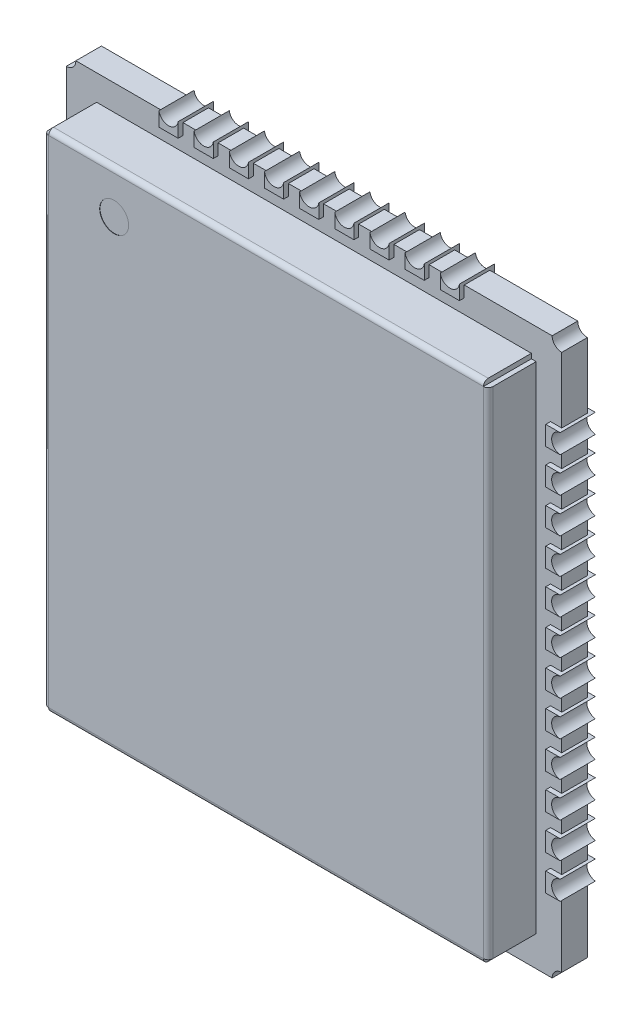
from build123d import *

# Parameters (mm, degrees)
SKETCH_1_W                     = 15.5
SKETCH_1_H                     = 17.4
EXTRUDE_1_DEPTH                = 0.8
SKETCH_2_W                     = 13.9
SKETCH_2_H                     = 15.8
EXTRUDE_2_DEPTH                = 1.5
SKETCH_3_W                     = 0.15
SKETCH_3_H                     = 0.15
CUT_EXTRUDE_1_DEPTH            = 1.5
FILLET_1_R                     = 0.15
EXTRUDE_START                  = -2.65
EXTRUDE_3_DEPTH                = 0.3
CUT_EXTRUDE_2_DEPTH            = 12.795550008
PATTERN_LINEAR_1_COUNT         = 12
PATTERN_LINEAR_1_PITCH         = 1.1
PATTERN_START                  = -2.65
PATTERN_LINEAR_1_COPY_1_DEPTH  = 0.3
PATTERN_LINEAR_1_COPY_2_DEPTH  = 0.3
PATTERN_LINEAR_1_COPY_3_DEPTH  = 0.3
PATTERN_LINEAR_1_COPY_4_DEPTH  = 0.3
PATTERN_LINEAR_1_COPY_5_DEPTH  = 0.3
PATTERN_LINEAR_1_COPY_6_DEPTH  = 0.3
PATTERN_LINEAR_1_COPY_7_DEPTH  = 0.3
PATTERN_LINEAR_1_COPY_8_DEPTH  = 0.3
PATTERN_LINEAR_1_COPY_9_DEPTH  = 0.3
PATTERN_LINEAR_1_COPY_10_DEPTH = 0.3
PATTERN_LINEAR_1_COPY_11_DEPTH = 0.3
PATTERN_LINEAR_1_COPY_12_DEPTH = 12.795550008
PATTERN_LINEAR_1_COPY_13_DEPTH = 12.795550008
PATTERN_LINEAR_1_COPY_14_DEPTH = 12.795550008
PATTERN_LINEAR_1_COPY_15_DEPTH = 12.795550008
PATTERN_LINEAR_1_COPY_16_DEPTH = 12.795550008
PATTERN_LINEAR_1_COPY_17_DEPTH = 12.795550008
PATTERN_LINEAR_1_COPY_18_DEPTH = 12.795550008
PATTERN_LINEAR_1_COPY_19_DEPTH = 12.795550008
PATTERN_LINEAR_1_COPY_20_DEPTH = 12.795550008
PATTERN_LINEAR_1_COPY_21_DEPTH = 12.795550008
PATTERN_LINEAR_1_COPY_22_DEPTH = 12.795550008
EXTRUDE_START_2                = -3.35
EXTRUDE_4_DEPTH                = 0.3
CUT_EXTRUDE_3_DEPTH            = 12.869498726
PATTERN_LINEAR_2_COUNT         = 9
PATTERN_LINEAR_2_PITCH         = 1.1
PATTERN_START_2                = -3.35
PATTERN_LINEAR_2_COPY_1_DEPTH  = 0.3
PATTERN_LINEAR_2_COPY_2_DEPTH  = 0.3
PATTERN_LINEAR_2_COPY_3_DEPTH  = 0.3
PATTERN_LINEAR_2_COPY_4_DEPTH  = 0.3
PATTERN_LINEAR_2_COPY_5_DEPTH  = 0.3
PATTERN_LINEAR_2_COPY_6_DEPTH  = 0.3
PATTERN_LINEAR_2_COPY_7_DEPTH  = 0.3
PATTERN_LINEAR_2_COPY_8_DEPTH  = 0.3
PATTERN_LINEAR_2_COPY_9_DEPTH  = 12.869498726
PATTERN_LINEAR_2_COPY_10_DEPTH = 12.869498726
PATTERN_LINEAR_2_COPY_11_DEPTH = 12.869498726
PATTERN_LINEAR_2_COPY_12_DEPTH = 12.869498726
PATTERN_LINEAR_2_COPY_13_DEPTH = 12.869498726
PATTERN_LINEAR_2_COPY_14_DEPTH = 12.869498726
PATTERN_LINEAR_2_COPY_15_DEPTH = 12.869498726
PATTERN_LINEAR_2_COPY_16_DEPTH = 12.869498726
SKETCH_10_W                    = 0.2
SKETCH_10_H                    = 0.6
CUT_EXTRUDE_5_DEPTH            = 0.15
SKETCH_11_W                    = 0.2
SKETCH_11_H                    = 0.6
EXTRUDE_5_DEPTH                = 0.15
EXTRUDE_6_DEPTH                = 0.15
SKETCH_13_W                    = 0.8
SKETCH_13_H                    = 1
EXTRUDE_7_DEPTH                = 0.15
SKETCH_14_W                    = 1
SKETCH_14_H                    = 0.8
EXTRUDE_8_DEPTH                = 0.15
PATTERN_LINEAR_3_COUNT         = 6
PATTERN_LINEAR_3_PITCH         = 1.4
SKETCH_15_W                    = 0.8
SKETCH_15_H                    = 1
EXTRUDE_9_DEPTH                = 0.15
PATTERN_LINEAR_5_COUNT         = 7
PATTERN_LINEAR_5_PITCH         = 1.4
SKETCH_16_W                    = 1
SKETCH_16_H                    = 0.8
EXTRUDE_10_DEPTH               = 0.15
PATTERN_LINEAR_6_COUNT         = 8
PATTERN_LINEAR_6_PITCH         = 1.4
PATTERN_LINEAR_7_COUNT         = 5
PATTERN_LINEAR_7_PITCH         = 1.4
SKETCH_17_W                    = 2.5
SKETCH_17_H                    = 3
EXTRUDE_11_DEPTH               = 0.15
SKETCH_18_W                    = 2.5
SKETCH_18_H                    = 3
EXTRUDE_12_DEPTH               = 0.15
SKETCH_19_W                    = 2.5
SKETCH_19_H                    = 3
EXTRUDE_13_DEPTH               = 0.15
SKETCH_20_W                    = 2.5
SKETCH_20_H                    = 3
EXTRUDE_14_DEPTH               = 0.15
SKETCH_22_W                    = 2.5
SKETCH_22_H                    = 3
EXTRUDE_15_DEPTH               = 0.15
CUT_EXTRUDE_6_DEPTH            = 0.15
SKETCH_24_R                    = 0.3
CUT_EXTRUDE_7_DEPTH            = 13.014678523
SKETCH_25_R                    = 0.452321789
CUT_EXTRUDE_8_DEPTH            = 0.01


with BuildPart() as part:
    # Эскиз1 → Бобышка-Вытянуть1 (new body)
    with BuildSketch(Plane.XY):
        Rectangle(SKETCH_1_W, SKETCH_1_H)
    extrude(amount=EXTRUDE_1_DEPTH)

    # Эскиз2 → Бобышка-Вытянуть2 (add)
    with BuildSketch(Plane.XY.offset(0.8)):
        Rectangle(SKETCH_2_W, SKETCH_2_H)
    extrude(amount=EXTRUDE_2_DEPTH)

    # Эскиз3 → Вырез-Вытянуть1 (cut)
    with BuildSketch(Plane.XY.offset(2.3)):
        with Locations((-6.875, 7.825)):
            Rectangle(SKETCH_3_W, SKETCH_3_H)
        with Locations((6.875, 7.825)):
            Rectangle(SKETCH_3_W, SKETCH_3_H)
        with Locations((6.875, -7.825)):
            Rectangle(SKETCH_3_W, SKETCH_3_H)
        with Locations((-6.875, -7.825)):
            Rectangle(SKETCH_3_W, SKETCH_3_H)
    extrude(amount=-CUT_EXTRUDE_1_DEPTH, mode=Mode.SUBTRACT)

    # Скругление1
    fillet_1_edges = [part.edges().sort_by_distance(p)[0] for p in [
        (0, 7.9, 2.3),
        (-6.95, 0, 2.3),
        (0, -7.9, 2.3),
        (6.95, 0, 2.3),
    ]]
    fillet(fillet_1_edges, radius=FILLET_1_R)

    # Эскиз4 → Бобышка-Вытянуть3 (add, symmetric)
    with BuildSketch(Plane.XZ.offset(8.7).offset(EXTRUDE_START)):
        Polygon((-7.4, 0.49840348), (-7.4, 0.95), (-7.85, 0.95), (-7.85, -0.15), (-6.85, -0.15), (-6.85, 0.49840348), align=None)
    extrude_3 = extrude(amount=EXTRUDE_3_DEPTH, both=True)

    # Эскиз5 → Вырез-Вытянуть2 (cut, through all)
    with BuildSketch(Plane.XY.offset(0.95)):
        with BuildLine():
            Line((-7.85, -5.75), (-7.85, -6.35))
            ThreePointArc((-7.85, -6.35), (-7.584195583, -6.05), (-7.85, -5.75))
        make_face()
    cut_extrude_2 = extrude(amount=-CUT_EXTRUDE_2_DEPTH, mode=Mode.SUBTRACT)

    # Зеркальное отражение1: Бобышка-Вытянуть3, Вырез-Вытянуть2 across plane
    add(extrude_3.mirror(Plane(origin=(0, 0, 0), x_dir=(0, 0, 1), z_dir=(1, 0, 0))))
    add(cut_extrude_2.mirror(Plane(origin=(0, 0, 0), x_dir=(0, 0, 1), z_dir=(1, 0, 0))), mode=Mode.SUBTRACT)

    # Линейный массив1: Бобышка-Вытянуть3, Вырез-Вытянуть2 ×12
    with Locations(*[(0, i * PATTERN_LINEAR_1_PITCH, 0) for i in range(1, PATTERN_LINEAR_1_COUNT)]):
        add(extrude_3)
        add(cut_extrude_2, mode=Mode.SUBTRACT)

    # Линейный массив1 copy 1 sketch → Линейный массив1 copy 1 (add, symmetric)
    with BuildSketch(Plane(origin=(0, -7.6, 0), x_dir=(-1, 0, 0), z_dir=(0, -1, 0)).offset(PATTERN_START)):
        Polygon((-7.4, -0.49840348), (-7.4, -0.95), (-7.85, -0.95), (-7.85, 0.15), (-6.85, 0.15), (-6.85, -0.49840348), align=None)
    extrude(amount=PATTERN_LINEAR_1_COPY_1_DEPTH, both=True)

    # Линейный массив1 copy 2 sketch → Линейный массив1 copy 2 (add, symmetric)
    with BuildSketch(Plane(origin=(0, -6.5, 0), x_dir=(-1, 0, 0), z_dir=(0, -1, 0)).offset(PATTERN_START)):
        Polygon((-7.4, -0.49840348), (-7.4, -0.95), (-7.85, -0.95), (-7.85, 0.15), (-6.85, 0.15), (-6.85, -0.49840348), align=None)
    extrude(amount=PATTERN_LINEAR_1_COPY_2_DEPTH, both=True)

    # Линейный массив1 copy 3 sketch → Линейный массив1 copy 3 (add, symmetric)
    with BuildSketch(Plane(origin=(0, -5.4, 0), x_dir=(-1, 0, 0), z_dir=(0, -1, 0)).offset(PATTERN_START)):
        Polygon((-7.4, -0.49840348), (-7.4, -0.95), (-7.85, -0.95), (-7.85, 0.15), (-6.85, 0.15), (-6.85, -0.49840348), align=None)
    extrude(amount=PATTERN_LINEAR_1_COPY_3_DEPTH, both=True)

    # Линейный массив1 copy 4 sketch → Линейный массив1 copy 4 (add, symmetric)
    with BuildSketch(Plane(origin=(0, -4.3, 0), x_dir=(-1, 0, 0), z_dir=(0, -1, 0)).offset(PATTERN_START)):
        Polygon((-7.4, -0.49840348), (-7.4, -0.95), (-7.85, -0.95), (-7.85, 0.15), (-6.85, 0.15), (-6.85, -0.49840348), align=None)
    extrude(amount=PATTERN_LINEAR_1_COPY_4_DEPTH, both=True)

    # Линейный массив1 copy 5 sketch → Линейный массив1 copy 5 (add, symmetric)
    with BuildSketch(Plane(origin=(0, -3.2, 0), x_dir=(-1, 0, 0), z_dir=(0, -1, 0)).offset(PATTERN_START)):
        Polygon((-7.4, -0.49840348), (-7.4, -0.95), (-7.85, -0.95), (-7.85, 0.15), (-6.85, 0.15), (-6.85, -0.49840348), align=None)
    extrude(amount=PATTERN_LINEAR_1_COPY_5_DEPTH, both=True)

    # Линейный массив1 copy 6 sketch → Линейный массив1 copy 6 (add, symmetric)
    with BuildSketch(Plane(origin=(0, -2.1, 0), x_dir=(-1, 0, 0), z_dir=(0, -1, 0)).offset(PATTERN_START)):
        Polygon((-7.4, -0.49840348), (-7.4, -0.95), (-7.85, -0.95), (-7.85, 0.15), (-6.85, 0.15), (-6.85, -0.49840348), align=None)
    extrude(amount=PATTERN_LINEAR_1_COPY_6_DEPTH, both=True)

    # Линейный массив1 copy 7 sketch → Линейный массив1 copy 7 (add, symmetric)
    with BuildSketch(Plane(origin=(0, -1, 0), x_dir=(-1, 0, 0), z_dir=(0, -1, 0)).offset(PATTERN_START)):
        Polygon((-7.4, -0.49840348), (-7.4, -0.95), (-7.85, -0.95), (-7.85, 0.15), (-6.85, 0.15), (-6.85, -0.49840348), align=None)
    extrude(amount=PATTERN_LINEAR_1_COPY_7_DEPTH, both=True)

    # Линейный массив1 copy 8 sketch → Линейный массив1 copy 8 (add, symmetric)
    with BuildSketch(Plane(origin=(0, 0.1, 0), x_dir=(-1, 0, 0), z_dir=(0, -1, 0)).offset(PATTERN_START)):
        Polygon((-7.4, -0.49840348), (-7.4, -0.95), (-7.85, -0.95), (-7.85, 0.15), (-6.85, 0.15), (-6.85, -0.49840348), align=None)
    extrude(amount=PATTERN_LINEAR_1_COPY_8_DEPTH, both=True)

    # Линейный массив1 copy 9 sketch → Линейный массив1 copy 9 (add, symmetric)
    with BuildSketch(Plane(origin=(0, 1.2, 0), x_dir=(-1, 0, 0), z_dir=(0, -1, 0)).offset(PATTERN_START)):
        Polygon((-7.4, -0.49840348), (-7.4, -0.95), (-7.85, -0.95), (-7.85, 0.15), (-6.85, 0.15), (-6.85, -0.49840348), align=None)
    extrude(amount=PATTERN_LINEAR_1_COPY_9_DEPTH, both=True)

    # Линейный массив1 copy 10 sketch → Линейный массив1 copy 10 (add, symmetric)
    with BuildSketch(Plane(origin=(0, 2.3, 0), x_dir=(-1, 0, 0), z_dir=(0, -1, 0)).offset(PATTERN_START)):
        Polygon((-7.4, -0.49840348), (-7.4, -0.95), (-7.85, -0.95), (-7.85, 0.15), (-6.85, 0.15), (-6.85, -0.49840348), align=None)
    extrude(amount=PATTERN_LINEAR_1_COPY_10_DEPTH, both=True)

    # Линейный массив1 copy 11 sketch → Линейный массив1 copy 11 (add, symmetric)
    with BuildSketch(Plane(origin=(0, 3.4, 0), x_dir=(-1, 0, 0), z_dir=(0, -1, 0)).offset(PATTERN_START)):
        Polygon((-7.4, -0.49840348), (-7.4, -0.95), (-7.85, -0.95), (-7.85, 0.15), (-6.85, 0.15), (-6.85, -0.49840348), align=None)
    extrude(amount=PATTERN_LINEAR_1_COPY_11_DEPTH, both=True)

    # Линейный массив1 copy 12 sketch → Линейный массив1 copy 12 (cut, through all)
    with BuildSketch(Plane(origin=(0, 1.1, 0.95), x_dir=(-1, 0, 0), z_dir=(0, 0, 1))):
        with BuildLine():
            Line((-7.85, 5.75), (-7.85, 6.35))
            ThreePointArc((-7.85, 6.35), (-7.584195583, 6.05), (-7.85, 5.75))
        make_face()
    extrude(amount=-PATTERN_LINEAR_1_COPY_12_DEPTH, mode=Mode.SUBTRACT)

    # Линейный массив1 copy 13 sketch → Линейный массив1 copy 13 (cut, through all)
    with BuildSketch(Plane(origin=(0, 2.2, 0.95), x_dir=(-1, 0, 0), z_dir=(0, 0, 1))):
        with BuildLine():
            Line((-7.85, 5.75), (-7.85, 6.35))
            ThreePointArc((-7.85, 6.35), (-7.584195583, 6.05), (-7.85, 5.75))
        make_face()
    extrude(amount=-PATTERN_LINEAR_1_COPY_13_DEPTH, mode=Mode.SUBTRACT)

    # Линейный массив1 copy 14 sketch → Линейный массив1 copy 14 (cut, through all)
    with BuildSketch(Plane(origin=(0, 3.3, 0.95), x_dir=(-1, 0, 0), z_dir=(0, 0, 1))):
        with BuildLine():
            Line((-7.85, 5.75), (-7.85, 6.35))
            ThreePointArc((-7.85, 6.35), (-7.584195583, 6.05), (-7.85, 5.75))
        make_face()
    extrude(amount=-PATTERN_LINEAR_1_COPY_14_DEPTH, mode=Mode.SUBTRACT)

    # Линейный массив1 copy 15 sketch → Линейный массив1 copy 15 (cut, through all)
    with BuildSketch(Plane(origin=(0, 4.4, 0.95), x_dir=(-1, 0, 0), z_dir=(0, 0, 1))):
        with BuildLine():
            Line((-7.85, 5.75), (-7.85, 6.35))
            ThreePointArc((-7.85, 6.35), (-7.584195583, 6.05), (-7.85, 5.75))
        make_face()
    extrude(amount=-PATTERN_LINEAR_1_COPY_15_DEPTH, mode=Mode.SUBTRACT)

    # Линейный массив1 copy 16 sketch → Линейный массив1 copy 16 (cut, through all)
    with BuildSketch(Plane(origin=(0, 5.5, 0.95), x_dir=(-1, 0, 0), z_dir=(0, 0, 1))):
        with BuildLine():
            Line((-7.85, 5.75), (-7.85, 6.35))
            ThreePointArc((-7.85, 6.35), (-7.584195583, 6.05), (-7.85, 5.75))
        make_face()
    extrude(amount=-PATTERN_LINEAR_1_COPY_16_DEPTH, mode=Mode.SUBTRACT)

    # Линейный массив1 copy 17 sketch → Линейный массив1 copy 17 (cut, through all)
    with BuildSketch(Plane(origin=(0, 6.6, 0.95), x_dir=(-1, 0, 0), z_dir=(0, 0, 1))):
        with BuildLine():
            Line((-7.85, 5.75), (-7.85, 6.35))
            ThreePointArc((-7.85, 6.35), (-7.584195583, 6.05), (-7.85, 5.75))
        make_face()
    extrude(amount=-PATTERN_LINEAR_1_COPY_17_DEPTH, mode=Mode.SUBTRACT)

    # Линейный массив1 copy 18 sketch → Линейный массив1 copy 18 (cut, through all)
    with BuildSketch(Plane(origin=(0, 7.7, 0.95), x_dir=(-1, 0, 0), z_dir=(0, 0, 1))):
        with BuildLine():
            Line((-7.85, 5.75), (-7.85, 6.35))
            ThreePointArc((-7.85, 6.35), (-7.584195583, 6.05), (-7.85, 5.75))
        make_face()
    extrude(amount=-PATTERN_LINEAR_1_COPY_18_DEPTH, mode=Mode.SUBTRACT)

    # Линейный массив1 copy 19 sketch → Линейный массив1 copy 19 (cut, through all)
    with BuildSketch(Plane(origin=(0, 8.8, 0.95), x_dir=(-1, 0, 0), z_dir=(0, 0, 1))):
        with BuildLine():
            Line((-7.85, 5.75), (-7.85, 6.35))
            ThreePointArc((-7.85, 6.35), (-7.584195583, 6.05), (-7.85, 5.75))
        make_face()
    extrude(amount=-PATTERN_LINEAR_1_COPY_19_DEPTH, mode=Mode.SUBTRACT)

    # Линейный массив1 copy 20 sketch → Линейный массив1 copy 20 (cut, through all)
    with BuildSketch(Plane(origin=(0, 9.9, 0.95), x_dir=(-1, 0, 0), z_dir=(0, 0, 1))):
        with BuildLine():
            Line((-7.85, 5.75), (-7.85, 6.35))
            ThreePointArc((-7.85, 6.35), (-7.584195583, 6.05), (-7.85, 5.75))
        make_face()
    extrude(amount=-PATTERN_LINEAR_1_COPY_20_DEPTH, mode=Mode.SUBTRACT)

    # Линейный массив1 copy 21 sketch → Линейный массив1 copy 21 (cut, through all)
    with BuildSketch(Plane(origin=(0, 11, 0.95), x_dir=(-1, 0, 0), z_dir=(0, 0, 1))):
        with BuildLine():
            Line((-7.85, 5.75), (-7.85, 6.35))
            ThreePointArc((-7.85, 6.35), (-7.584195583, 6.05), (-7.85, 5.75))
        make_face()
    extrude(amount=-PATTERN_LINEAR_1_COPY_21_DEPTH, mode=Mode.SUBTRACT)

    # Линейный массив1 copy 22 sketch → Линейный массив1 copy 22 (cut, through all)
    with BuildSketch(Plane(origin=(0, 12.1, 0.95), x_dir=(-1, 0, 0), z_dir=(0, 0, 1))):
        with BuildLine():
            Line((-7.85, 5.75), (-7.85, 6.35))
            ThreePointArc((-7.85, 6.35), (-7.584195583, 6.05), (-7.85, 5.75))
        make_face()
    extrude(amount=-PATTERN_LINEAR_1_COPY_22_DEPTH, mode=Mode.SUBTRACT)

    # Эскиз6 → Бобышка-Вытянуть4 (add, symmetric)
    with BuildSketch(Plane.ZY.offset(7.75).offset(EXTRUDE_START_2)):
        Polygon((0.4, 7.8), (-0.15, 7.8), (-0.15, 8.8), (0.95, 8.8), (0.95, 8.35), (0.4, 8.35), align=None)
    extrude_4 = extrude(amount=EXTRUDE_4_DEPTH, both=True)

    # Эскиз7 → Вырез-Вытянуть3 (cut, through all)
    with BuildSketch(Plane.XY.offset(0.95)):
        with BuildLine():
            Line((-4.1, 8.8), (-4.7, 8.8))
            ThreePointArc((-4.7, 8.8), (-4.4, 8.540684104), (-4.1, 8.8))
        make_face()
    cut_extrude_3 = extrude(amount=-CUT_EXTRUDE_3_DEPTH, mode=Mode.SUBTRACT)

    # Зеркальное отражение2: Бобышка-Вытянуть4, Вырез-Вытянуть3 across plane
    add(extrude_4.mirror(Plane.ZX))
    add(cut_extrude_3.mirror(Plane.ZX), mode=Mode.SUBTRACT)

    # Линейный массив2: Бобышка-Вытянуть4, Вырез-Вытянуть3 ×9
    with Locations(*[(i * PATTERN_LINEAR_2_PITCH, 0, 0) for i in range(1, PATTERN_LINEAR_2_COUNT)]):
        add(extrude_4)
        add(cut_extrude_3, mode=Mode.SUBTRACT)

    # Линейный массив2 copy 1 sketch → Линейный массив2 copy 1 (add, symmetric)
    with BuildSketch(Plane.ZY.offset(6.65).offset(PATTERN_START_2)):
        Polygon((0.4, -7.8), (-0.15, -7.8), (-0.15, -8.8), (0.95, -8.8), (0.95, -8.35), (0.4, -8.35), align=None)
    extrude(amount=PATTERN_LINEAR_2_COPY_1_DEPTH, both=True)

    # Линейный массив2 copy 2 sketch → Линейный массив2 copy 2 (add, symmetric)
    with BuildSketch(Plane.ZY.offset(5.55).offset(PATTERN_START_2)):
        Polygon((0.4, -7.8), (-0.15, -7.8), (-0.15, -8.8), (0.95, -8.8), (0.95, -8.35), (0.4, -8.35), align=None)
    extrude(amount=PATTERN_LINEAR_2_COPY_2_DEPTH, both=True)

    # Линейный массив2 copy 3 sketch → Линейный массив2 copy 3 (add, symmetric)
    with BuildSketch(Plane.ZY.offset(4.45).offset(PATTERN_START_2)):
        Polygon((0.4, -7.8), (-0.15, -7.8), (-0.15, -8.8), (0.95, -8.8), (0.95, -8.35), (0.4, -8.35), align=None)
    extrude(amount=PATTERN_LINEAR_2_COPY_3_DEPTH, both=True)

    # Линейный массив2 copy 4 sketch → Линейный массив2 copy 4 (add, symmetric)
    with BuildSketch(Plane.ZY.offset(3.35).offset(PATTERN_START_2)):
        Polygon((0.4, -7.8), (-0.15, -7.8), (-0.15, -8.8), (0.95, -8.8), (0.95, -8.35), (0.4, -8.35), align=None)
    extrude(amount=PATTERN_LINEAR_2_COPY_4_DEPTH, both=True)

    # Линейный массив2 copy 5 sketch → Линейный массив2 copy 5 (add, symmetric)
    with BuildSketch(Plane.ZY.offset(2.25).offset(PATTERN_START_2)):
        Polygon((0.4, -7.8), (-0.15, -7.8), (-0.15, -8.8), (0.95, -8.8), (0.95, -8.35), (0.4, -8.35), align=None)
    extrude(amount=PATTERN_LINEAR_2_COPY_5_DEPTH, both=True)

    # Линейный массив2 copy 6 sketch → Линейный массив2 copy 6 (add, symmetric)
    with BuildSketch(Plane.ZY.offset(1.15).offset(PATTERN_START_2)):
        Polygon((0.4, -7.8), (-0.15, -7.8), (-0.15, -8.8), (0.95, -8.8), (0.95, -8.35), (0.4, -8.35), align=None)
    extrude(amount=PATTERN_LINEAR_2_COPY_6_DEPTH, both=True)

    # Линейный массив2 copy 7 sketch → Линейный массив2 copy 7 (add, symmetric)
    with BuildSketch(Plane.ZY.offset(0.05).offset(PATTERN_START_2)):
        Polygon((0.4, -7.8), (-0.15, -7.8), (-0.15, -8.8), (0.95, -8.8), (0.95, -8.35), (0.4, -8.35), align=None)
    extrude(amount=PATTERN_LINEAR_2_COPY_7_DEPTH, both=True)

    # Линейный массив2 copy 8 sketch → Линейный массив2 copy 8 (add, symmetric)
    with BuildSketch(Plane.ZY.offset(-1.05).offset(PATTERN_START_2)):
        Polygon((0.4, -7.8), (-0.15, -7.8), (-0.15, -8.8), (0.95, -8.8), (0.95, -8.35), (0.4, -8.35), align=None)
    extrude(amount=PATTERN_LINEAR_2_COPY_8_DEPTH, both=True)

    # Линейный массив2 copy 9 sketch → Линейный массив2 copy 9 (cut, through all)
    with BuildSketch(Plane(origin=(1.1, 0, 0.95), x_dir=(1, 0, 0), z_dir=(0, 0, 1))):
        with BuildLine():
            Line((-4.1, -8.8), (-4.7, -8.8))
            ThreePointArc((-4.7, -8.8), (-4.4, -8.540684104), (-4.1, -8.8))
        make_face()
    extrude(amount=-PATTERN_LINEAR_2_COPY_9_DEPTH, mode=Mode.SUBTRACT)

    # Линейный массив2 copy 10 sketch → Линейный массив2 copy 10 (cut, through all)
    with BuildSketch(Plane(origin=(2.2, 0, 0.95), x_dir=(1, 0, 0), z_dir=(0, 0, 1))):
        with BuildLine():
            Line((-4.1, -8.8), (-4.7, -8.8))
            ThreePointArc((-4.7, -8.8), (-4.4, -8.540684104), (-4.1, -8.8))
        make_face()
    extrude(amount=-PATTERN_LINEAR_2_COPY_10_DEPTH, mode=Mode.SUBTRACT)

    # Линейный массив2 copy 11 sketch → Линейный массив2 copy 11 (cut, through all)
    with BuildSketch(Plane(origin=(3.3, 0, 0.95), x_dir=(1, 0, 0), z_dir=(0, 0, 1))):
        with BuildLine():
            Line((-4.1, -8.8), (-4.7, -8.8))
            ThreePointArc((-4.7, -8.8), (-4.4, -8.540684104), (-4.1, -8.8))
        make_face()
    extrude(amount=-PATTERN_LINEAR_2_COPY_11_DEPTH, mode=Mode.SUBTRACT)

    # Линейный массив2 copy 12 sketch → Линейный массив2 copy 12 (cut, through all)
    with BuildSketch(Plane(origin=(4.4, 0, 0.95), x_dir=(1, 0, 0), z_dir=(0, 0, 1))):
        with BuildLine():
            Line((-4.1, -8.8), (-4.7, -8.8))
            ThreePointArc((-4.7, -8.8), (-4.4, -8.540684104), (-4.1, -8.8))
        make_face()
    extrude(amount=-PATTERN_LINEAR_2_COPY_12_DEPTH, mode=Mode.SUBTRACT)

    # Линейный массив2 copy 13 sketch → Линейный массив2 copy 13 (cut, through all)
    with BuildSketch(Plane(origin=(5.5, 0, 0.95), x_dir=(1, 0, 0), z_dir=(0, 0, 1))):
        with BuildLine():
            Line((-4.1, -8.8), (-4.7, -8.8))
            ThreePointArc((-4.7, -8.8), (-4.4, -8.540684104), (-4.1, -8.8))
        make_face()
    extrude(amount=-PATTERN_LINEAR_2_COPY_13_DEPTH, mode=Mode.SUBTRACT)

    # Линейный массив2 copy 14 sketch → Линейный массив2 copy 14 (cut, through all)
    with BuildSketch(Plane(origin=(6.6, 0, 0.95), x_dir=(1, 0, 0), z_dir=(0, 0, 1))):
        with BuildLine():
            Line((-4.1, -8.8), (-4.7, -8.8))
            ThreePointArc((-4.7, -8.8), (-4.4, -8.540684104), (-4.1, -8.8))
        make_face()
    extrude(amount=-PATTERN_LINEAR_2_COPY_14_DEPTH, mode=Mode.SUBTRACT)

    # Линейный массив2 copy 15 sketch → Линейный массив2 copy 15 (cut, through all)
    with BuildSketch(Plane(origin=(7.7, 0, 0.95), x_dir=(1, 0, 0), z_dir=(0, 0, 1))):
        with BuildLine():
            Line((-4.1, -8.8), (-4.7, -8.8))
            ThreePointArc((-4.7, -8.8), (-4.4, -8.540684104), (-4.1, -8.8))
        make_face()
    extrude(amount=-PATTERN_LINEAR_2_COPY_15_DEPTH, mode=Mode.SUBTRACT)

    # Линейный массив2 copy 16 sketch → Линейный массив2 copy 16 (cut, through all)
    with BuildSketch(Plane(origin=(8.8, 0, 0.95), x_dir=(1, 0, 0), z_dir=(0, 0, 1))):
        with BuildLine():
            Line((-4.1, -8.8), (-4.7, -8.8))
            ThreePointArc((-4.7, -8.8), (-4.4, -8.540684104), (-4.1, -8.8))
        make_face()
    extrude(amount=-PATTERN_LINEAR_2_COPY_16_DEPTH, mode=Mode.SUBTRACT)

    # Эскиз10 → Вырез-Вытянуть5 (cut)
    with BuildSketch(Plane(origin=(0, 0, 0), x_dir=(-1, 0, 0), z_dir=(0, 0, -1))):
        with Locations((-6.95, 6.05)):
            Rectangle(SKETCH_10_W, SKETCH_10_H)
        with Locations((-6.95, 3.85)):
            Rectangle(SKETCH_10_W, SKETCH_10_H)
        with Locations((-6.95, 2.75)):
            Rectangle(SKETCH_10_W, SKETCH_10_H)
    extrude(amount=CUT_EXTRUDE_5_DEPTH, mode=Mode.SUBTRACT)

    # Эскиз11 → Бобышка-Вытянуть5 (add)
    with BuildSketch(Plane(origin=(0, 0, 0), x_dir=(-1, 0, 0), z_dir=(0, 0, -1))):
        with Locations((-6.75, 4.95)):
            Rectangle(SKETCH_11_W, SKETCH_11_H)
    extrude(amount=EXTRUDE_5_DEPTH)

    # Эскиз12 → Бобышка-Вытянуть6 (add)
    with BuildSketch(Plane(origin=(0, 0, 0), x_dir=(-1, 0, 0), z_dir=(0, 0, -1))):
        with BuildLine():
            Line((-6.55, 7.217314697), (-6.55, 6.145375462))
            ThreePointArc((-6.55, 6.145375462), (-5.9, 5.048789852), (-6.55, 3.952204242))
            Line((-6.55, 3.952204242), (-6.55, 2.880265008))
            ThreePointArc((-6.55, 2.880265008), (-4.9, 5.048789852), (-6.55, 7.217314697))
        make_face()
    extrude(amount=EXTRUDE_6_DEPTH)

    # Эскиз13 → Бобышка-Вытянуть7 (add)
    with BuildSketch(Plane(origin=(0, 0, 0), x_dir=(-1, 0, 0), z_dir=(0, 0, -1))):
        with Locations((4.2, 6.3)):
            Rectangle(SKETCH_13_W, SKETCH_13_H)
    extrude_7 = extrude(amount=EXTRUDE_7_DEPTH)

    # Эскиз14 → Бобышка-Вытянуть8 (add)
    with BuildSketch(Plane(origin=(0, 0, 0), x_dir=(-1, 0, 0), z_dir=(0, 0, -1))):
        with Locations((5.35, -4.9)):
            Rectangle(SKETCH_14_W, SKETCH_14_H)
    extrude_8 = extrude(amount=EXTRUDE_8_DEPTH)

    # Линейный массив3: Бобышка-Вытянуть7 ×6
    with Locations(*[(i * PATTERN_LINEAR_3_PITCH, 0, 0) for i in range(1, PATTERN_LINEAR_3_COUNT)]):
        add(extrude_7)

    # Эскиз15 → Бобышка-Вытянуть9 (add)
    with BuildSketch(Plane(origin=(0, 0, 0), x_dir=(-1, 0, 0), z_dir=(0, 0, -1))):
        with Locations((4.2, -6.3)):
            Rectangle(SKETCH_15_W, SKETCH_15_H)
    extrude_9 = extrude(amount=EXTRUDE_9_DEPTH)

    # Линейный массив5: Бобышка-Вытянуть9 ×7
    with Locations(*[(i * PATTERN_LINEAR_5_PITCH, 0, 0) for i in range(1, PATTERN_LINEAR_5_COUNT)]):
        add(extrude_9)

    # Эскиз16 → Бобышка-Вытянуть10 (add)
    with BuildSketch(Plane(origin=(0, 0, 0), x_dir=(-1, 0, 0), z_dir=(0, 0, -1))):
        with Locations((-5.35, -4.9)):
            Rectangle(SKETCH_16_W, SKETCH_16_H)
        with Locations((5.35, -4.9)):
            Rectangle(SKETCH_16_W, SKETCH_16_H)
    extrude_10 = extrude(amount=EXTRUDE_10_DEPTH)

    # Линейный массив6: Бобышка-Вытянуть8 ×8
    with Locations(*[(0, i * PATTERN_LINEAR_6_PITCH, 0) for i in range(1, PATTERN_LINEAR_6_COUNT)]):
        add(extrude_8)

    # Линейный массив7: Бобышка-Вытянуть10 ×5
    with Locations(*[(0, i * PATTERN_LINEAR_7_PITCH, 0) for i in range(1, PATTERN_LINEAR_7_COUNT)]):
        add(extrude_10)

    # Эскиз17 → Бобышка-Вытянуть11 (add)
    with BuildSketch(Plane(origin=(0, 0, 0), x_dir=(-1, 0, 0), z_dir=(0, 0, -1))):
        with Locations((-2.9, 3.4)):
            Rectangle(SKETCH_17_W, SKETCH_17_H)
    extrude_11 = extrude(amount=EXTRUDE_11_DEPTH)

    # Эскиз18 → Бобышка-Вытянуть12 (add)
    with BuildSketch(Plane(origin=(0, 0, 0), x_dir=(-1, 0, 0), z_dir=(0, 0, -1))):
        with Locations((-2.9, 0)):
            Rectangle(SKETCH_18_W, SKETCH_18_H)
    extrude_12 = extrude(amount=EXTRUDE_12_DEPTH)

    # Эскиз19 → Бобышка-Вытянуть13 (add)
    with BuildSketch(Plane(origin=(0, 0, 0), x_dir=(-1, 0, 0), z_dir=(0, 0, -1))):
        Rectangle(SKETCH_19_W, SKETCH_19_H)
    extrude(amount=EXTRUDE_13_DEPTH)

    # Эскиз20 → Бобышка-Вытянуть14 (add)
    with BuildSketch(Plane(origin=(0, 0, 0), x_dir=(-1, 0, 0), z_dir=(0, 0, -1))):
        with Locations((0, 3.4)):
            Rectangle(SKETCH_20_W, SKETCH_20_H)
    extrude_14 = extrude(amount=EXTRUDE_14_DEPTH)

    # Эскиз22 → Бобышка-Вытянуть15 (add)
    with BuildSketch(Plane(origin=(0, 0, 0), x_dir=(-1, 0, 0), z_dir=(0, 0, -1))):
        with Locations((-2.9, -3.4)):
            Rectangle(SKETCH_22_W, SKETCH_22_H)
    extrude_15 = extrude(amount=EXTRUDE_15_DEPTH)

    # Зеркальное отражение5: Бобышка-Вытянуть14 across plane
    add(extrude_14.mirror(Plane.ZX))

    # Зеркальное отражение6: Бобышка-Вытянуть11, Бобышка-Вытянуть12, Бобышка-Вытянуть15 across plane
    add(extrude_11.mirror(Plane(origin=(0, 0, 0), x_dir=(0, 0, 1), z_dir=(1, 0, 0))))
    add(extrude_12.mirror(Plane(origin=(0, 0, 0), x_dir=(0, 0, 1), z_dir=(1, 0, 0))))
    add(extrude_15.mirror(Plane(origin=(0, 0, 0), x_dir=(0, 0, 1), z_dir=(1, 0, 0))))

    # Эскиз23 → Вырез-Вытянуть6 (cut)
    with BuildSketch(Plane(origin=(0, 0, -0.15), x_dir=(-1, 0, 0), z_dir=(0, 0, -1))):
        Polygon((3.15, 4.9), (4.15, 4.9), (4.15, 3.9), align=None)
    extrude(amount=-CUT_EXTRUDE_6_DEPTH, mode=Mode.SUBTRACT)

    # Эскиз24 → Вырез-Вытянуть7 (cut, through all)
    with BuildSketch(Plane(origin=(0, 0, 0), x_dir=(-1, 0, 0), z_dir=(0, 0, -1))):
        with Locations((-7.75, -8.7)):
            Circle(SKETCH_24_R)
        with Locations((7.75, -8.7)):
            Circle(SKETCH_24_R)
        with Locations((-7.75, 8.7)):
            Circle(SKETCH_24_R)
        with Locations((7.75, 8.7)):
            Circle(SKETCH_24_R)
    extrude(amount=-CUT_EXTRUDE_7_DEPTH, mode=Mode.SUBTRACT)

    # Эскиз25 → Вырез-Вытянуть8 (cut)
    with BuildSketch(Plane.XY.offset(2.3)):
        with Locations((-4.751165514, 6.565871307)):
            Circle(SKETCH_25_R)
    extrude(amount=-CUT_EXTRUDE_8_DEPTH, mode=Mode.SUBTRACT)


solid = part.part
